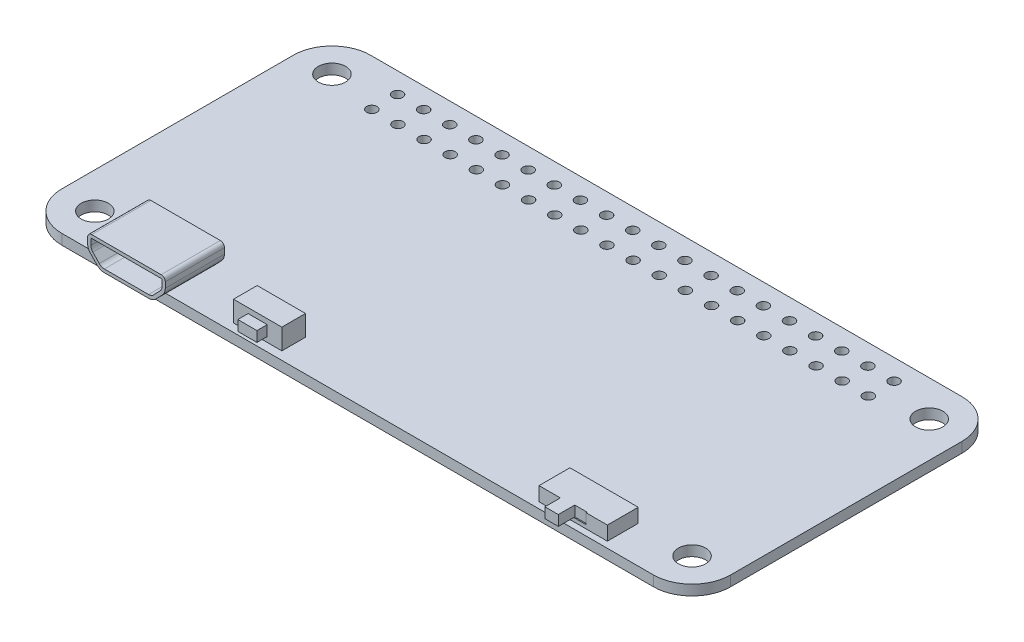
from build123d import *

# Parameters (mm, degrees)
BOSS_EXTRUDE1_DEPTH       = 1
SKETCH2_R                 = 1.325
CUT_EXTRUDE1_DEPTH        = 36.80851854
SKETCH3_R                 = 0.5
CUT_EXTRUDE2_DEPTH        = 36.80851854
LPATTERN1_COUNT           = 20
LPATTERN1_PITCH           = 2.54
BOSS_EXTRUDE6_DEPTH       = 1.25
BOSS_EXTRUDE6_DEPTH_BACK  = 4.5
CUT_EXTRUDE9_DEPTH        = 5.25
SKETCH_1_W                = 4.7
SKETCH_1_H                = 2.3
EXTRUDE_1_DEPTH           = 2
SKETCH_2_W                = 1.86
SKETCH_2_H                = 1
EXTRUDE_2_DEPTH           = 1
SKETCH_3_W                = 2.5
SKETCH_3_H                = 1.25
EXTRUDE_3_DEPTH           = 0.8
SKETCH_4_W                = 3.3
SKETCH_4_H                = 1
SKETCH_4_W_2              = 3.41377373
EXTRUDE_4_DEPTH           = 0.6
SKETCH_5_W                = 1.2
SKETCH_5_H                = 1
EXTRUDE_5_DEPTH           = 0.9
EXTRUDE_5_DRAFT           = 22
EXTRUDE_5_PROFILE_2_DEPTH = 0.9
EXTRUDE_5_PROFILE_2_DRAFT = 22
SKETCH_6_W                = 6.64
SKETCH_6_H                = 3
EXTRUDE_6_DEPTH           = 1.36
SKETCH_7_W                = 2.5
SKETCH_7_H                = 1
CUT_EXTRUDE_1_DEPTH       = 0.1
SKETCH_8_W                = 1.3
SKETCH_8_H                = 1
EXTRUDE_7_DEPTH           = 1.6


with BuildPart() as part:
    # Sketch1 → Boss-Extrude1 (new body)
    with BuildSketch(Plane(origin=(0, 0, 0), x_dir=(1, 0, 0), z_dir=(0, 1, 0))):
        with BuildLine():
            Line((-28.75, 15), (28.75, 15))
            ThreePointArc((28.75, 15), (31.401650429, 13.901650429), (32.5, 11.25))
            Line((32.5, 11.25), (32.5, -11.25))
            ThreePointArc((32.5, -11.25), (31.401650429, -13.901650429), (28.75, -15))
            Line((28.75, -15), (-28.75, -15))
            ThreePointArc((-28.75, -15), (-31.401650429, -13.901650429), (-32.5, -11.25))
            Line((-32.5, -11.25), (-32.5, 11.25))
            ThreePointArc((-32.5, 11.25), (-31.401650429, 13.901650429), (-28.75, 15))
        make_face()
    extrude(amount=BOSS_EXTRUDE1_DEPTH)

    # Sketch2 → Cut-Extrude1 (cut, through all)
    with BuildSketch(Plane(origin=(0, 1, 0), x_dir=(1, 0, 0), z_dir=(0, 1, 0))):
        with Locations((-29.025, 11.525)):
            Circle(SKETCH2_R)
        with Locations((29.025, 11.525)):
            Circle(SKETCH2_R)
        with Locations((29.025, -11.525)):
            Circle(SKETCH2_R)
        with Locations((-29.025, -11.525)):
            Circle(SKETCH2_R)
    extrude(amount=-CUT_EXTRUDE1_DEPTH, mode=Mode.SUBTRACT)

    # Sketch3 → Cut-Extrude2 (cut, through all)
    with BuildSketch(Plane(origin=(0, 1, 0), x_dir=(1, 0, 0), z_dir=(0, 1, 0))):
        with Locations((-24.128, 13)):
            Circle(SKETCH3_R)
        with Locations((-24.128, 10.5)):
            Circle(SKETCH3_R)
    cut_extrude2 = extrude(amount=-CUT_EXTRUDE2_DEPTH, mode=Mode.SUBTRACT)

    # LPattern1: Cut-Extrude2 ×20
    with Locations(*[(i * LPATTERN1_PITCH, 0, 0) for i in range(1, LPATTERN1_COUNT)]):
        add(cut_extrude2, mode=Mode.SUBTRACT)

    # Sketch15 → Boss-Extrude6 (add, two sides: drawn at the far end of the back side and taken through both)
    with BuildSketch(Plane.XY.offset(15).offset(-BOSS_EXTRUDE6_DEPTH_BACK)):
        with BuildLine():
            Line((-24.6, 3.6), (-17.85, 3.6))
            ThreePointArc((-17.85, 3.6), (-17.567157288, 3.482842712), (-17.45, 3.2))
            Line((-17.45, 3.2), (-17.45, 2.652310288))
            ThreePointArc((-17.45, 2.652310288), (-17.522264229, 2.279072643), (-17.728612679, 1.959778459))
            Line((-17.728612679, 1.959778459), (-18.354830555, 1.307468172))
            ThreePointArc((-18.354830555, 1.307468172), (-18.684128491, 1.080072876), (-19.076217876, 1))
            Line((-19.076217876, 1), (-23.373782124, 1))
            ThreePointArc((-23.373782124, 1), (-23.765871509, 1.080072876), (-24.095169445, 1.307468172))
            Line((-24.095169445, 1.307468172), (-24.721387321, 1.959778459))
            ThreePointArc((-24.721387321, 1.959778459), (-24.927735771, 2.279072643), (-25, 2.652310288))
            Line((-25, 2.652310288), (-25, 3.2))
            ThreePointArc((-25, 3.2), (-24.882842712, 3.482842712), (-24.6, 3.6))
        make_face()
    extrude(amount=BOSS_EXTRUDE6_DEPTH + BOSS_EXTRUDE6_DEPTH_BACK)

    # Sketch16 → Cut-Extrude9 (cut)
    with BuildSketch(Plane.XY.offset(16.25)):
        with BuildLine():
            Line((-18.585674498, 1.529078357), (-17.959456622, 2.181388644))
            ThreePointArc((-17.959456622, 2.181388644), (-17.819139676, 2.398508689), (-17.77, 2.652310288))
            Line((-17.77, 2.652310288), (-17.77, 3.2))
            ThreePointArc((-17.77, 3.2), (-17.793431458, 3.256568542), (-17.85, 3.28))
            Line((-17.85, 3.28), (-24.6, 3.28))
            ThreePointArc((-24.6, 3.28), (-24.656568542, 3.256568542), (-24.68, 3.2))
            Line((-24.68, 3.2), (-24.68, 2.652310288))
            ThreePointArc((-24.68, 2.652310288), (-24.630860324, 2.398508689), (-24.490543378, 2.181388644))
            Line((-24.490543378, 2.181388644), (-23.864325502, 1.529078357))
            ThreePointArc((-23.864325502, 1.529078357), (-23.640402906, 1.374449555), (-23.373782124, 1.32))
            Line((-23.373782124, 1.32), (-19.076217876, 1.32))
            ThreePointArc((-19.076217876, 1.32), (-18.809597094, 1.374449555), (-18.585674498, 1.529078357))
        make_face()
    extrude(amount=-CUT_EXTRUDE9_DEPTH, mode=Mode.SUBTRACT)

    # 草图1 → 凸台-拉伸1 (add)
    with BuildSketch(Plane(origin=(0, 1, 0), x_dir=(1, 0, 0), z_dir=(0, 1, 0))):
        with Locations((-10.52, -13.05)):
            Rectangle(SKETCH_1_W, SKETCH_1_H)
    extrude(amount=EXTRUDE_1_DEPTH)

    # 草图2 → 凸台-拉伸2 (add)
    with BuildSketch(Plane.XY.offset(14.2)):
        with Locations((-10.52, 2)):
            Rectangle(SKETCH_2_W, SKETCH_2_H)
    extrude(amount=EXTRUDE_2_DEPTH)

    # 草图3 → 凸台-拉伸3 (add)
    with BuildSketch(Plane.XZ):
        with Locations((-29.65, -6.375)):
            Rectangle(SKETCH_3_W, SKETCH_3_H)
        with Locations((-29.65, -2.525)):
            Rectangle(SKETCH_3_W, SKETCH_3_H)
        with Locations((-29.65, 1.325)):
            Rectangle(SKETCH_3_W, SKETCH_3_H)
        with Locations((-29.65, 5.175)):
            Rectangle(SKETCH_3_W, SKETCH_3_H)
    extrude(amount=EXTRUDE_3_DEPTH)

    # 草图4 → 凸台-拉伸4 (add)
    with BuildSketch(Plane.XZ):
        with Locations((-20.99, 11.18)):
            Rectangle(SKETCH_4_W, SKETCH_4_H)
        with Locations((-20.933113135, 8.88)):
            Rectangle(SKETCH_4_W_2, SKETCH_4_H)
    extrude(amount=EXTRUDE_4_DEPTH)


with BuildPart() as extrude_5_tool:
    # 草图5 → 凸台-拉伸5 (with draft: the straight prism first)
    with BuildSketch(Plane.XZ.offset(0.6)):
        with Locations((-22.04, 8.88)):
            Rectangle(SKETCH_5_W, SKETCH_5_H)
    extrude(amount=EXTRUDE_5_DEPTH)
    # 凸台-拉伸5: the draft: its side faces are tilted about the plane it starts from
    extrude_5_sides = [extrude_5_tool.faces().sort_by_distance(p)[0] for p in [
        (-22.04, -1.05, 8.38),
        (-21.44, -1.05, 8.88),
        (-22.04, -1.05, 9.38),
        (-22.64, -1.05, 8.88),
    ]]
    draft(extrude_5_sides, Plane.XZ.offset(0.6), EXTRUDE_5_DRAFT)


with BuildPart() as part_1:
    add(part.part)

    # 凸台-拉伸5: add extrude_5_tool
    add(extrude_5_tool.part)


with BuildPart() as extrude_5_profile_2_tool:
    # 草图5 → 凸台-拉伸5 profile 2 (with draft: the straight prism first)
    with BuildSketch(Plane.XZ.offset(0.6)):
        with Locations((-22.04, 11.18)):
            Rectangle(SKETCH_5_W, SKETCH_5_H)
    extrude(amount=EXTRUDE_5_PROFILE_2_DEPTH)
    # 凸台-拉伸5 profile 2: the draft: its side faces are tilted about the plane it starts from
    extrude_5_profile_2_sides = [extrude_5_profile_2_tool.faces().sort_by_distance(p)[0] for p in [
        (-22.04, -1.05, 10.68),
        (-21.44, -1.05, 11.18),
        (-22.04, -1.05, 11.68),
        (-22.64, -1.05, 11.18),
    ]]
    draft(extrude_5_profile_2_sides, Plane.XZ.offset(0.6), EXTRUDE_5_PROFILE_2_DRAFT)


with BuildPart() as part_2:
    add(part_1.part)

    # 凸台-拉伸5 profile 2: add extrude_5_profile_2_tool
    add(extrude_5_profile_2_tool.part)

    # 草图6 → 凸台-拉伸6 (add)
    with BuildSketch(Plane(origin=(0, 1, 0), x_dir=(1, 0, 0), z_dir=(0, 1, 0))):
        with Locations((20.35, -12.9)):
            Rectangle(SKETCH_6_W, SKETCH_6_H)
    extrude(amount=EXTRUDE_6_DEPTH)

    # 草图7 → 切除-拉伸1 (cut)
    with BuildSketch(Plane.XY.offset(14.4)):
        with Locations((20.35, 1.86)):
            Rectangle(SKETCH_7_W, SKETCH_7_H)
    extrude(amount=-CUT_EXTRUDE_1_DEPTH, mode=Mode.SUBTRACT)

    # 草图8 → 凸台-拉伸7 (add)
    with BuildSketch(Plane.XY.offset(14.3)):
        with Locations((19.75, 1.86)):
            Rectangle(SKETCH_8_W, SKETCH_8_H)
    extrude(amount=EXTRUDE_7_DEPTH)


solid = part_2.part
